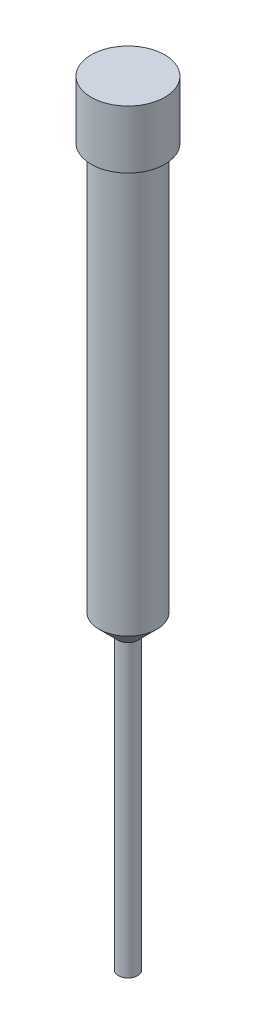
from build123d import *

# Parameters (mm, degrees)
SKETCH3_R           = 0.5
BOSS_EXTRUDE4_DEPTH = 25
SKETCH5_R           = 1.5
BOSS_EXTRUDE5_DEPTH = 15
CHAMFER2_SIZE       = 10
SKETCH6_R           = 1.900672983
BOSS_EXTRUDE6_DEPTH = 3


with BuildPart() as part:
    # Sketch3 → Boss-Extrude4 (new body)
    with BuildSketch(Plane(origin=(0, 0, 0), x_dir=(1, 0, 0), z_dir=(0, 1, 0))):
        with Locations(Location((0, 0, 0), (0, 0, 270))):
            Circle(SKETCH3_R)
    extrude(amount=BOSS_EXTRUDE4_DEPTH)

    # Sketch5 → Boss-Extrude5 (add)
    with BuildSketch(Plane(origin=(0, 25, 0), x_dir=(1, 0, 0), z_dir=(0, 1, 0))):
        with Locations(Location((0, 0, 0), (0, 0, 270))):
            Circle(SKETCH5_R)
    extrude(amount=BOSS_EXTRUDE5_DEPTH)

    # Chamfer2
    # the kernel refuses this chamfer: 10 mm, written as the material it adds along each edge
    with BuildSketch(Plane(origin=(0, 25, 0), x_dir=(0, 0, 1), z_dir=(-1, 0, 0))) as chamfer2_piece_1_section:
        Polygon((0.5 + CHAMFER2_SIZE, 0), (0.5, -CHAMFER2_SIZE), (0.5, 0), align=None)
    chamfer2_piece_1 = revolve(axis=Axis((0, 25, 0), (0, 1, 0)), mode=Mode.PRIVATE)
    chamfer2_piece_1 = chamfer2_piece_1 & Plane(origin=(0, 15.387158422, 0), x_dir=(0, 0, 1), z_dir=(0, -1, 0)) * Cylinder(1.5, 42, mode=Mode.PRIVATE)
    add(chamfer2_piece_1)

    # Sketch6 → Boss-Extrude6 (add)
    with BuildSketch(Plane(origin=(0, 40, 0), x_dir=(1, 0, 0), z_dir=(0, 1, 0))):
        with Locations(Location((0, 0, 0), (0, 0, 270))):
            Circle(SKETCH6_R)
    extrude(amount=-BOSS_EXTRUDE6_DEPTH)


solid = part.part
